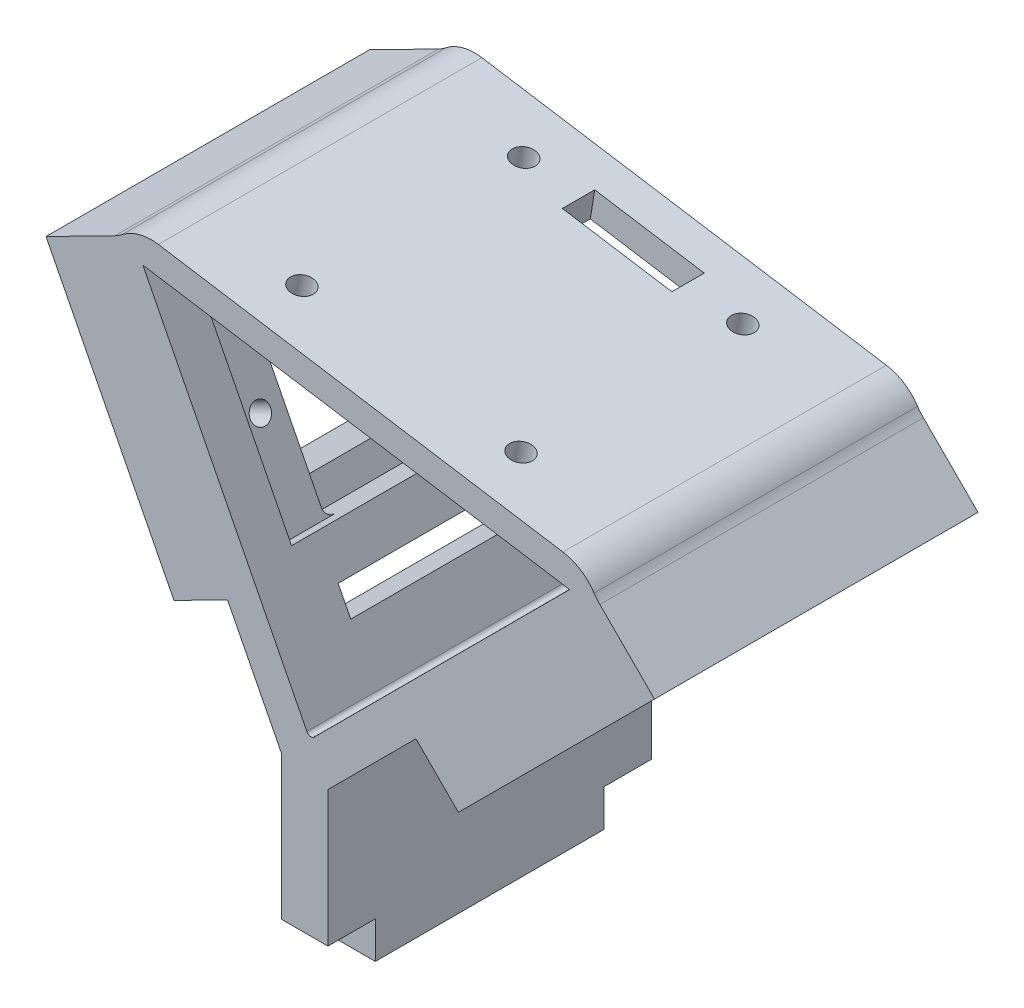
from build123d import *

# Parameters (mm, degrees)
BOSS_EXTRUDE1_DEPTH      = 35
BOSS_EXTRUDE2_DEPTH      = 35
FILLET1_R                = 0.5
SKETCH3_W                = 26
SKETCH3_H                = 25
CUT_EXTRUDE1_DEPTH       = 1.5
SKETCH4_W                = 16
SKETCH4_H                = 25
CUT_EXTRUDE2_DEPTH       = 5
FILLET3_R                = 1
SKETCH5_W                = 26
SKETCH5_H                = 25
CUT_EXTRUDE3_DEPTH       = 1.5
SKETCH6_W                = 16
SKETCH6_H                = 25
CUT_EXTRUDE4_DEPTH       = 5
FILLET4_R                = 1
SKETCH8_W                = 20
SKETCH8_H                = 3
CUT_EXTRUDE5_DEPTH       = 4
SKETCH9_W                = 20
SKETCH9_H                = 3
CUT_EXTRUDE6_DEPTH       = 4
SKETCH10_W               = 20
SKETCH10_H               = 3
CUT_EXTRUDE7_DEPTH       = 4
SKETCH11_R               = 1.1
CUT_EXTRUDE8_DEPTH       = 10
SKETCH12_R               = 1.1
CUT_EXTRUDE9_DEPTH       = 5
BOSS_EXTRUDE3_DEPTH      = 3.5
BOSS_EXTRUDE3_DEPTH_BACK = 1
SKETCH14_W               = 35
SKETCH14_H               = 3.801557548
SKETCH15_W               = 1.5
SKETCH15_H               = 31
CUT_EXTRUDE10_DEPTH      = 5
SKETCH18_W               = 35
SKETCH18_H               = 30
SKETCH18_R               = 1.1
SKETCH18_W_2             = 16
SKETCH18_H_2             = 20
BOSS_EXTRUDE4_DEPTH      = 6.5
SKETCH19_W               = 35
SKETCH19_H               = 30.5
SKETCH19_R               = 1.1
SKETCH19_W_2             = 16
SKETCH19_H_2             = 17.5
BOSS_EXTRUDE5_DEPTH      = 6.5
CUT_EXTRUDE12_DEPTH      = 2.5
CUT_EXTRUDE12_DEPTH_BACK = 10
SKETCH20_W               = 93.401628658
SKETCH20_H               = 53.255346894
SKETCH21_W               = 5
SKETCH21_H               = 4
CUT_EXTRUDE13_DEPTH      = 5.125
FILLET9_R                = 2
FILLET10_R               = 2
BOSS_EXTRUDE6_DEPTH      = 35
SKETCH23_W               = 49.664604729
SKETCH23_H               = 35
BOSS_EXTRUDE7_DEPTH      = 1
SKETCH24_R               = 1.25
SKETCH24_W               = 12
SKETCH24_H               = 3.5
CUT_EXTRUDE14_DEPTH      = 5
FILLET13_R               = 5
FILLET14_R               = 5


with BuildPart() as part:
    # Sketch1 → Boss-Extrude1 (new body)
    with BuildSketch(Plane.XY):
        Polygon((6.55, 4.55), (-6.55, 4.55), (-6.55, -4.55), (-2.05, -4.55), (-2.05, -2.05), (-4.05, -2.05), (-4.05, 2.05), (4.05, 2.05), (4.05, -2.05), (2.05, -2.05), (2.05, -4.55), (6.55, -4.55), align=None)
    extrude(amount=BOSS_EXTRUDE1_DEPTH)

    # Sketch2 → Boss-Extrude2 (add, through all)
    with BuildSketch(Plane.XY.offset(35)):
        Polygon((2.5, 4.55), (2.5, 25.721572875), (33.234018716, 56.455591591), (30.405591591, 59.284018716), (0.532284417, 29.410711541), (-18.64755944, 67.053274588), (-22.211585537, 65.237312589), (-2.5, 26.551147735), (-2.5, 4.55), align=None)
    extrude(amount=-BOSS_EXTRUDE2_DEPTH)

    # Fillet1
    fillet1_edges = [part.edges().sort_by_distance(p)[0] for p in [
        (0.532284417, 29.410711541, 17.5),
    ]]
    fillet(fillet1_edges, radius=FILLET1_R)

    # Sketch3 → Cut-Extrude1 (cut)
    with BuildSketch(Plane(origin=(-14.439213562, 14.439213562, 0), x_dir=(0, 0, 1), z_dir=(-0.7071067811865464, 0.7071067811865488, 0))):
        with Locations((17.5, 47.92013165)):
            Rectangle(SKETCH3_W, SKETCH3_H)
    extrude(amount=-CUT_EXTRUDE1_DEPTH, mode=Mode.SUBTRACT)

    # Sketch4 → Cut-Extrude2 (cut)
    with BuildSketch(Plane(origin=(-13.378553391, 13.378553391, 0), x_dir=(0, 0, 1), z_dir=(-0.7071067811865461, 0.707106781186549, 0))):
        with Locations((17.5, 47.92013165)):
            Rectangle(SKETCH4_W, SKETCH4_H)
    extrude(amount=-CUT_EXTRUDE2_DEPTH, mode=Mode.SUBTRACT)

    # Fillet3
    fillet3_edges = [part.edges().sort_by_distance(p)[0] for p in [
        (30.228814896, 55.218154724, 9.5),
        (30.228814896, 55.218154724, 25.5),
        (12.551145366, 37.540485194, 25.5),
        (12.551145366, 37.540485194, 9.5),
    ]]
    fillet(fillet3_edges, radius=FILLET3_R)

    # Sketch5 → Cut-Extrude3 (cut)
    with BuildSketch(Plane(origin=(12.3194594, 6.277078088, 0), x_dir=(0, 0, -1), z_dir=(0.8910065241883675, 0.45399049973954786, 0))):
        with Locations((-17.5, 52.710719955)):
            Rectangle(SKETCH5_W, SKETCH5_H)
    extrude(amount=-CUT_EXTRUDE3_DEPTH, mode=Mode.SUBTRACT)

    # Sketch6 → Cut-Extrude4 (cut)
    with BuildSketch(Plane(origin=(10.982949614, 5.596092339, 0), x_dir=(0, 0, -1), z_dir=(0.8910065241883673, 0.4539904997395479, 0))):
        with Locations((-17.5, 52.710719955)):
            Rectangle(SKETCH6_W, SKETCH6_H)
    extrude(amount=-CUT_EXTRUDE4_DEPTH, mode=Mode.SUBTRACT)

    # Fillet4
    fillet4_edges = [part.edges().sort_by_distance(p)[0] for p in [
        (-19.735855882, 63.131781141, 25.5),
        (-19.735855882, 63.131781141, 9.5),
        (-8.386093389, 40.856618036, 9.5),
        (-8.386093389, 40.856618036, 25.5),
    ]]
    fillet(fillet4_edges, radius=FILLET4_R)

    # Sketch8 → Cut-Extrude5 (cut)
    with BuildSketch(Plane(origin=(-11.610786438, 11.610786438, 0), x_dir=(0, 0, -1), z_dir=(0.7071067811865465, -0.7071067811865487, 0))):
        with Locations((-17.5, 29.42013165)):
            Rectangle(SKETCH8_W, SKETCH8_H)
    extrude(amount=-CUT_EXTRUDE5_DEPTH, mode=Mode.SUBTRACT)

    # Sketch9 → Cut-Extrude6 (cut)
    with BuildSketch(Plane(origin=(8.755433303, 4.461116089, 0), x_dir=(0, 0, 1), z_dir=(-0.8910065241883675, -0.45399049973954797, 0))):
        with Locations((17.5, 34.210719955)):
            Rectangle(SKETCH9_W, SKETCH9_H)
    extrude(amount=-CUT_EXTRUDE6_DEPTH, mode=Mode.SUBTRACT)

    # Sketch10 → Cut-Extrude7 (cut)
    with BuildSketch(Plane.ZY.offset(2.5)):
        with Locations((17.5, 19.55)):
            Rectangle(SKETCH10_W, SKETCH10_H)
    extrude(amount=-CUT_EXTRUDE7_DEPTH, mode=Mode.SUBTRACT)

    # Sketch11 → Cut-Extrude8 (cut)
    with BuildSketch(Plane(origin=(-13.378553391, 13.378553391, 0), x_dir=(0, 0, 1), z_dir=(-0.7071067811865461, 0.707106781186549, 0))):
        with Locations(Location((28, 57.92013165, 0), (0, 0, 270))):
            Circle(SKETCH11_R)
        with Locations(Location((7, 57.92013165, 0), (0, 0, 270))):
            Circle(SKETCH11_R)
        with Locations(Location((28, 45.42013165, 0), (0, 0, 270))):
            Circle(SKETCH11_R)
        with Locations(Location((7, 45.42013165, 0), (0, 0, 270))):
            Circle(SKETCH11_R)
    extrude(amount=-CUT_EXTRUDE8_DEPTH, mode=Mode.SUBTRACT)

    # Sketch12 → Cut-Extrude9 (cut)
    with BuildSketch(Plane(origin=(10.982949614, 5.596092339, 0), x_dir=(0, 0, -1), z_dir=(0.8910065241883673, 0.4539904997395479, 0))):
        with Locations(Location((-7, 62.710719955, 0), (0, 0, 90))):
            Circle(SKETCH12_R)
        with Locations(Location((-28, 62.710719955, 0), (0, 0, 90))):
            Circle(SKETCH12_R)
        with Locations(Location((-7, 50.210719955, 0), (0, 0, 90))):
            Circle(SKETCH12_R)
        with Locations(Location((-28, 50.210719955, 0), (0, 0, 90))):
            Circle(SKETCH12_R)
    extrude(amount=-CUT_EXTRUDE9_DEPTH, mode=Mode.SUBTRACT)

    # Sketch14 → Boss-Extrude3 (add, two sides: drawn at the far end of the back side and taken through both)
    with BuildSketch(Plane(origin=(6.55, 0, 0), x_dir=(0, 0, -1), z_dir=(1, 0, 0)).offset(-BOSS_EXTRUDE3_DEPTH_BACK)):
        with Locations((-17.5, -0.05)):
            Rectangle(SKETCH14_W, SKETCH14_H)
    extrude(amount=BOSS_EXTRUDE3_DEPTH + BOSS_EXTRUDE3_DEPTH_BACK)

    # Sketch15 → Cut-Extrude10 (cut)
    with BuildSketch(Plane(origin=(0, 1.850778774, 0), x_dir=(1, 0, 0), z_dir=(0, 1, 0))):
        with Locations((7.3, -17.5)):
            Rectangle(SKETCH15_W, SKETCH15_H)
    extrude(amount=-CUT_EXTRUDE10_DEPTH, mode=Mode.SUBTRACT)

    # Sketch18 → Boss-Extrude4 (add)
    with BuildSketch(Plane(origin=(-11.610786438, 11.610786438, 0), x_dir=(0, 0, -1), z_dir=(0.7071067811865465, -0.7071067811865487, 0))):
        with Locations((-17.5, 48.42013165)):
            Rectangle(SKETCH18_W, SKETCH18_H)
        with Locations(Location((-7, 57.92013165, 0), (0, 0, 270))):
            Circle(SKETCH18_R, mode=Mode.SUBTRACT)
        with Locations(Location((-7, 45.42013165, 0), (0, 0, 270))):
            Circle(SKETCH18_R, mode=Mode.SUBTRACT)
        with Locations(Location((-28, 45.42013165, 0), (0, 0, 270))):
            Circle(SKETCH18_R, mode=Mode.SUBTRACT)
        with Locations(Location((-28, 57.92013165, 0), (0, 0, 270))):
            Circle(SKETCH18_R, mode=Mode.SUBTRACT)
        with Locations((-17.5, 48.92013165)):
            Rectangle(SKETCH18_W_2, SKETCH18_H_2, mode=Mode.SUBTRACT)
    extrude(amount=BOSS_EXTRUDE4_DEPTH)

    # Sketch19 → Boss-Extrude5 (add)
    with BuildSketch(Plane(origin=(8.755433303, 4.461116089, 0), x_dir=(0, 0, 1), z_dir=(-0.8910065241883673, -0.45399049973954797, 0))):
        with Locations((17.5, 52.960719955)):
            Rectangle(SKETCH19_W, SKETCH19_H)
        with Locations(Location((28, 50.210719955, 0), (0, 0, 90))):
            Circle(SKETCH19_R, mode=Mode.SUBTRACT)
        with Locations(Location((7, 50.210719955, 0), (0, 0, 90))):
            Circle(SKETCH19_R, mode=Mode.SUBTRACT)
        with Locations(Location((7, 62.710719955, 0), (0, 0, 90))):
            Circle(SKETCH19_R, mode=Mode.SUBTRACT)
        with Locations(Location((28, 62.710719955, 0), (0, 0, 90))):
            Circle(SKETCH19_R, mode=Mode.SUBTRACT)
        with Locations((17.5, 51.960719955)):
            Rectangle(SKETCH19_W_2, SKETCH19_H_2, mode=Mode.SUBTRACT)
    extrude(amount=BOSS_EXTRUDE5_DEPTH)

    # Sketch20 → Cut-Extrude12 (cut, two sides: drawn at the far end of the back side and taken through both)
    with BuildSketch(Plane(origin=(0, 4.55, 0), x_dir=(1, 0, 0), z_dir=(0, 1, 0)).offset(-CUT_EXTRUDE12_DEPTH_BACK)):
        with Locations((0, -16.396538254)):
            Rectangle(SKETCH20_W, SKETCH20_H)
    extrude(amount=CUT_EXTRUDE12_DEPTH + CUT_EXTRUDE12_DEPTH_BACK, mode=Mode.SUBTRACT)

    # Sketch21 → Cut-Extrude13 (cut)
    with BuildSketch(Plane.XY.offset(35)):
        with Locations((0, 9.05)):
            Rectangle(SKETCH21_W, SKETCH21_H)
    cut_extrude13 = extrude(amount=-CUT_EXTRUDE13_DEPTH, mode=Mode.SUBTRACT)

    # Mirror1: Cut-Extrude13 across plane
    add(cut_extrude13.mirror(Plane(origin=(0, 0, 17.5), x_dir=(1, 0, 0), z_dir=(0, 0, -1))), mode=Mode.SUBTRACT)

    # Fillet9
    fillet9_edges = [part.edges().sort_by_distance(p)[0] for p in [
        (-21.702427992, 57.079294533, 9.5),
        (-13.757594247, 41.48668036, 9.5),
        (-13.757594247, 41.48668036, 25.5),
        (-21.702427992, 57.079294533, 25.5),
    ]]
    fillet(fillet9_edges, radius=FILLET9_R)

    # Fillet10
    fillet10_edges = [part.edges().sort_by_distance(p)[0] for p in [
        (32.350135239, 50.975514037, 25.5),
        (18.207999616, 36.833378413, 25.5),
        (18.207999616, 36.833378413, 9.5),
        (32.350135239, 50.975514037, 9.5),
    ]]
    fillet(fillet10_edges, radius=FILLET10_R)

    # Sketch22 → Boss-Extrude6 (add, through all)
    with BuildSketch(Plane.XY.offset(35)):
        Polygon((-18.075827696, 64.935012284), (29.454185425, 57.406997757), (32.814896967, 56.87471334), (30.405591591, 59.284018716), (-18.64755944, 67.053274588), (-20.449809722, 65.9700605), align=None)
    extrude(amount=-BOSS_EXTRUDE6_DEPTH)

    # Sketch23 → Boss-Extrude7 (add)
    with BuildSketch(Plane(origin=(9.903962427, 62.531157777, 0), x_dir=(0.9876883405951378, -0.15643446504023123, 0), z_dir=(0.15643446504023123, 0.9876883405951378, 0))):
        with Locations((-4.075117815, -17.5)):
            Rectangle(SKETCH23_W, SKETCH23_H)
    extrude(amount=BOSS_EXTRUDE7_DEPTH)

    # Sketch24 → Cut-Extrude14 (cut)
    with BuildSketch(Plane(origin=(10.060396892, 63.518846117, 0), x_dir=(0.9876883405951378, -0.15643446504023123, 0), z_dir=(0.15643446504023123, 0.9876883405951378, 0))):
        with Locations(Location((-16.075117814, -5.5, 0), (0, 0, 180))):
            Circle(SKETCH24_R)
        with Locations(Location((7.924882186, -5.5, 0), (0, 0, 180))):
            Circle(SKETCH24_R)
        with Locations(Location((7.924882186, -29.5, 0), (0, 0, 180))):
            Circle(SKETCH24_R)
        with Locations(Location((-16.075117814, -29.5, 0), (0, 0, 180))):
            Circle(SKETCH24_R)
        with Locations((-4.075117814, -5.5)):
            Rectangle(SKETCH24_W, SKETCH24_H)
    extrude(amount=-CUT_EXTRUDE14_DEPTH, mode=Mode.SUBTRACT)

    # Fillet13
    # the kernel refuses this fillet: 5 mm, written as the material it adds along each edge
    with BuildSketch(Plane(origin=(-18.64755944, 67.053274588, 35), x_dir=(0.15643446504022016, 0.9876883405951395, 0), z_dir=(0, 0, -1))) as fillet13_piece_1:
        with BuildLine():
            CenterArc((2.787779592, -4.669458655), FILLET13_R, 110.950172263, 33.049827737)
            Line((-1.25730538, -1.730532394), (-1.338207079, -1.671753868))
            Line((-1.338207079, -1.671753868), (-0.080901699, 0.058778525))
            Line((-0.080901699, 0.058778525), (0, 0.1))
            ThreePointArc((0, 0.1), (0.5, 0.1), (0.964244408, 0.093389173))
            Line((0.964244408, 0.093389173), (1, 0))
        make_face()
    extrude(amount=35)
    with BuildSketch(Plane(origin=(30.405591591, 59.284018716, 35), x_dir=(0.7071067811865468, -0.7071067811865485, 0), z_dir=(0, 0, -1))) as fillet13_piece_2:
        with BuildLine():
            CenterArc((2.139055676, -5), FILLET13_R, 90, 33.049827737)
            Line((-0.587785252, -0.809016994), (-0.642322071, -0.725197334))
            ThreePointArc((-0.642322071, -0.725197334), (-0.374794326, -0.345729972), (-0.080901699, 0.058778525))
            Line((-0.080901699, 0.058778525), (0, 0.1))
            Line((0, 0.1), (2.139055676, 0.1))
            Line((2.139055676, 0.1), (2.139055676, 0))
        make_face()
    extrude(amount=35)

    # Fillet14
    fillet14_edges = [part.edges().sort_by_distance(p)[0] for p in [
        (-18.491124975, 68.040962929, 17.5),
        (30.562026056, 60.271707056, 17.5),
    ]]
    fillet(fillet14_edges, radius=FILLET14_R)


solid = part.part
